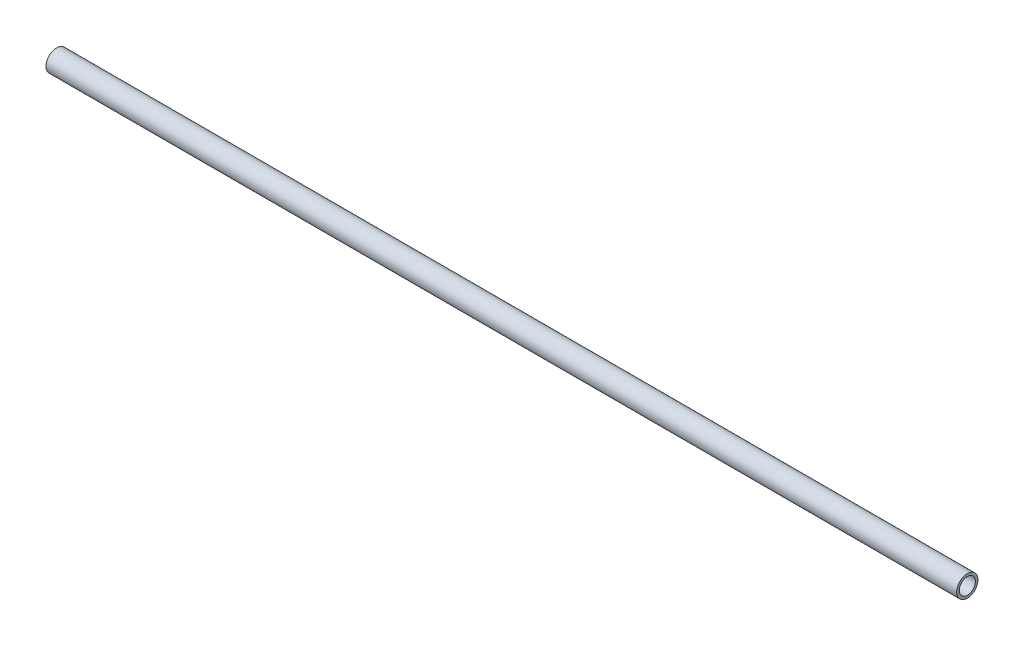
from build123d import *

# Parameters (mm, degrees)
SKETCH1_R           = 1.0541
SKETCH1_R_2         = 0.8001
BOSS_EXTRUDE1_DEPTH = 90
CUT_EXTRUDE2_DEPTH  = 10


with BuildPart() as part:
    # Sketch1 → Boss-Extrude1 (new body)
    with BuildSketch(Plane(origin=(0, 0, 0), x_dir=(0, 0, -1), z_dir=(1, 0, 0))):
        Circle(SKETCH1_R)
        Circle(SKETCH1_R_2, mode=Mode.SUBTRACT)
    extrude(amount=BOSS_EXTRUDE1_DEPTH)

    # Sketch3 → Cut-Extrude2 (cut)
    with BuildSketch(Plane.XY):
        with BuildLine():
            Line((1.079657865, 0.396875), (2.579657865, 0.396875))
            ThreePointArc((2.579657865, 0.396875), (2.976532865, 0), (2.579657865, -0.396875))
            Line((2.579657865, -0.396875), (1.079657865, -0.396875))
            ThreePointArc((1.079657865, -0.396875), (0.682782865, 0), (1.079657865, 0.396875))
        make_face()
    extrude(amount=-CUT_EXTRUDE2_DEPTH, mode=Mode.SUBTRACT)


solid = part.part
